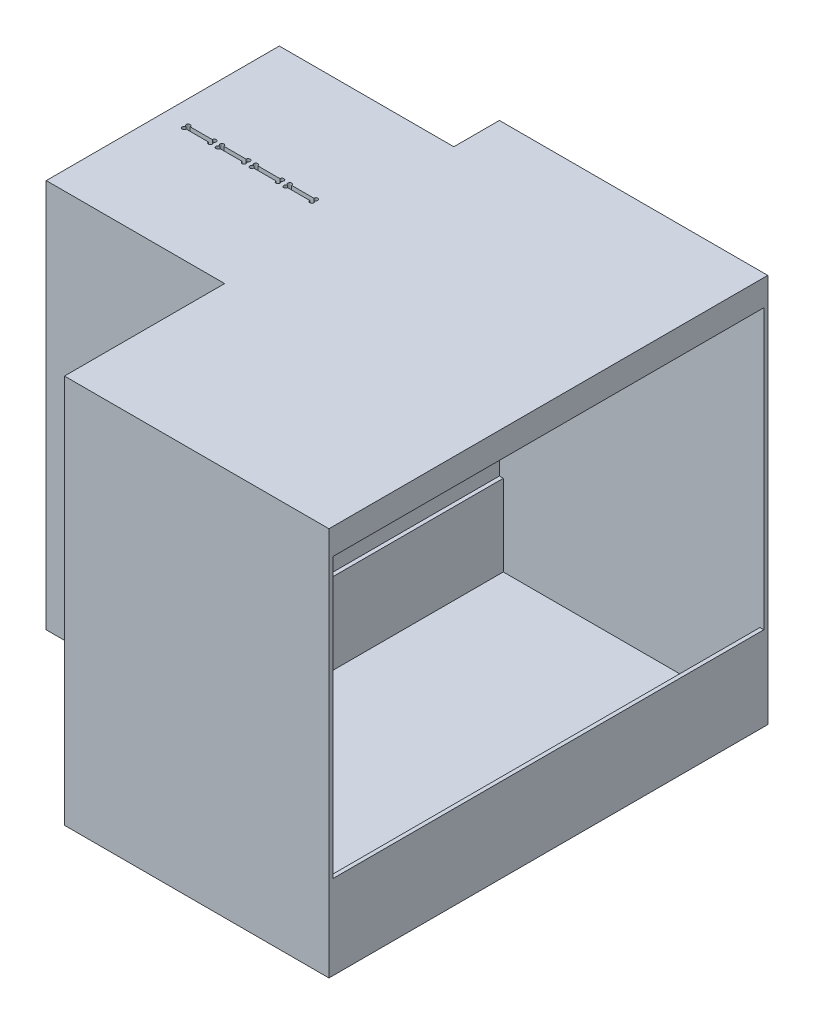
from build123d import *

# Parameters (mm, degrees)
SKETCH_3490_W                        = 374
SKETCH_3490_H                        = 597.6
EXTRUDE_3668_DEPTH                   = 680.2
SKETCH_3709_W                        = 368
SKETCH_3709_H                        = 427
CUT_EXTRUDE_3768_DEPTH               = 406.2
SKETCH_3818_W                        = 170
SKETCH_3818_H                        = 183
CUT_EXTRUDE_3910_DEPTH               = 256
SKETCH_3961_W                        = 170
SKETCH_3961_H                        = 183
CUT_EXTRUDE_4290_DEPTH               = 767.1086607
SKETCH_4336_W                        = 394.2
SKETCH_4336_H                        = 368
CUT_EXTRUDE_4864_DEPTH               = 124.6
SKETCH_4913_W                        = 394.2
SKETCH_4913_H                        = 368
CUT_EXTRUDE_5053_DEPTH               = 34
SKETCH_5123_W                        = 15.454545454
SKETCH_5123_H                        = 12
CUT_EXTRUDE_5277_DEPTH               = 256
PATTERN_LINEAR_5331_COUNT            = 5
PATTERN_LINEAR_5331_PITCH            = 30.909090909
PATTERN_LINEAR_5399_COUNT            = 2
PATTERN_LINEAR_5399_PITCH            = 176
PATTERN_LINEAR_5399_COUNT_DIR2       = 2
PATTERN_LINEAR_5399_PITCH_DIR2       = 201
PATTERN_LINEAR_5399_COPY_1_SKETCH_W  = 15.454545454
PATTERN_LINEAR_5399_COPY_1_SKETCH_H  = 12
PATTERN_LINEAR_5399_COPY_1_DEPTH     = 256
PATTERN_LINEAR_5399_COPY_2_SKETCH_W  = 15.454545454
PATTERN_LINEAR_5399_COPY_2_SKETCH_H  = 12
PATTERN_LINEAR_5399_COPY_2_DEPTH     = 256
PATTERN_LINEAR_5399_COPY_3_SKETCH_W  = 15.454545454
PATTERN_LINEAR_5399_COPY_3_SKETCH_H  = 12
PATTERN_LINEAR_5399_COPY_3_DEPTH     = 256
PATTERN_LINEAR_5399_COPY_4_SKETCH_W  = 15.454545454
PATTERN_LINEAR_5399_COPY_4_SKETCH_H  = 12
PATTERN_LINEAR_5399_COPY_4_DEPTH     = 256
PATTERN_LINEAR_5399_COPY_5_SKETCH_W  = 15.454545454
PATTERN_LINEAR_5399_COPY_5_SKETCH_H  = 12
PATTERN_LINEAR_5399_COPY_5_DEPTH     = 256
PATTERN_LINEAR_5399_COPY_6_SKETCH_W  = 15.454545454
PATTERN_LINEAR_5399_COPY_6_SKETCH_H  = 12
PATTERN_LINEAR_5399_COPY_6_DEPTH     = 256
PATTERN_LINEAR_5399_COPY_7_SKETCH_W  = 15.454545454
PATTERN_LINEAR_5399_COPY_7_SKETCH_H  = 12
PATTERN_LINEAR_5399_COPY_7_DEPTH     = 256
PATTERN_LINEAR_5399_COPY_8_SKETCH_W  = 15.454545454
PATTERN_LINEAR_5399_COPY_8_SKETCH_H  = 12
PATTERN_LINEAR_5399_COPY_8_DEPTH     = 256
PATTERN_LINEAR_5399_COPY_9_SKETCH_W  = 15.454545454
PATTERN_LINEAR_5399_COPY_9_SKETCH_H  = 12
PATTERN_LINEAR_5399_COPY_9_DEPTH     = 256
PATTERN_LINEAR_5399_COPY_10_SKETCH_W = 15.454545454
PATTERN_LINEAR_5399_COPY_10_SKETCH_H = 12
PATTERN_LINEAR_5399_COPY_10_DEPTH    = 256
PATTERN_LINEAR_5399_COPY_11_SKETCH_W = 15.454545454
PATTERN_LINEAR_5399_COPY_11_SKETCH_H = 12
PATTERN_LINEAR_5399_COPY_11_DEPTH    = 256
PATTERN_LINEAR_5399_COPY_12_SKETCH_W = 15.454545454
PATTERN_LINEAR_5399_COPY_12_SKETCH_H = 12
PATTERN_LINEAR_5399_COPY_12_DEPTH    = 256
EXTRUDE_6088_DEPTH                   = 240
SKETCH_6169_W                        = 406.2
SKETCH_6169_H                        = 597.6
EXTRUDE_6328_DEPTH                   = 6
SKETCH_14_W                          = 268
SKETCH_14_H                          = 597.6
CUT_EXTRUDE_1_DEPTH                  = 16
CUT_EXTRUDE_2_REACH                  = 861.908
SKETCH_15_W                          = 608
SKETCH_15_H                          = 124.6
SKETCH_16_W                          = 608
SKETCH_16_H                          = 123.22
EXTRUDE_1_DEPTH                      = 6
MOVE_FACE_6953_BY                    = 54
MOVE_FACE_6953_2_BY                  = 54
OTHER_START                          = 286.8
OTHER_1_DEPTH                        = 12
OTHER_START_2                        = -298.8
OTHER_2_DEPTH                        = 12


# Read off the part's stored shape, not the designer's step: Выступы и прорези-Прорезь1, Выступы и прорези-Прорезь2
with BuildPart() as part:
    # Sketch 3490 → Extrude 3668 (new body)
    with BuildSketch(Plane(origin=(0, 0, 0), x_dir=(0, 0, -1), z_dir=(1, 0, 0))):
        Rectangle(SKETCH_3490_W, SKETCH_3490_H)
    extrude(amount=EXTRUDE_3668_DEPTH)

    # Sketch 3709 → Cut-Extrude 3768 (cut)
    with BuildSketch(Plane(origin=(680.2, 0, 0), x_dir=(0, 0, -1), z_dir=(1, 0, 0))):
        with Locations((-3, 45.3)):
            Rectangle(SKETCH_3709_W, SKETCH_3709_H)
    extrude(amount=-CUT_EXTRUDE_3768_DEPTH, mode=Mode.SUBTRACT)

    # Sketch 3818 → Cut-Extrude 3910 (cut)
    with BuildSketch(Plane(origin=(274, 0, 0), x_dir=(0, 0, -1), z_dir=(1, 0, 0))):
        with Locations((-96, 167.3)):
            Rectangle(SKETCH_3818_W, SKETCH_3818_H)
    cut_extrude_3910 = extrude(amount=-CUT_EXTRUDE_3910_DEPTH, mode=Mode.SUBTRACT)

    # Sketch 3961 → Cut-Extrude 4290 (cut, through all)
    with BuildSketch(Plane.ZY):
        with Locations((96, 167.3)):
            Rectangle(SKETCH_3961_W, SKETCH_3961_H)
    cut_extrude_4290 = extrude(amount=-CUT_EXTRUDE_4290_DEPTH, mode=Mode.SUBTRACT)

    # Sketch 4336 → Cut-Extrude 4864 (cut)
    with BuildSketch(Plane(origin=(0, -168.2, 0), x_dir=(1, 0, 0), z_dir=(0, 1, 0))):
        with Locations((477.1, -3)):
            Rectangle(SKETCH_4336_W, SKETCH_4336_H)
    extrude(amount=-CUT_EXTRUDE_4864_DEPTH, mode=Mode.SUBTRACT)

    # Sketch 4913 → Cut-Extrude 5053 (cut)
    with BuildSketch(Plane.XZ.offset(-258.8)):
        with Locations((477.1, 3)):
            Rectangle(SKETCH_4913_W, SKETCH_4913_H)
    extrude(amount=-CUT_EXTRUDE_5053_DEPTH, mode=Mode.SUBTRACT)

    # Sketch 5123 → Cut-Extrude 5277 (cut)
    with BuildSketch(Plane(origin=(274, 0, 0), x_dir=(0, 0, -1), z_dir=(1, 0, 0))):
        with Locations((-157.818181818, 69.8)):
            Rectangle(SKETCH_5123_W, SKETCH_5123_H)
    cut_extrude_5277 = extrude(amount=-CUT_EXTRUDE_5277_DEPTH, mode=Mode.SUBTRACT)

    # Pattern Linear 5331: Cut-Extrude 5277 ×5
    with Locations(*[(0, 0, -i * PATTERN_LINEAR_5331_PITCH) for i in range(1, PATTERN_LINEAR_5331_COUNT)]):
        add(cut_extrude_5277, mode=Mode.SUBTRACT)

    # Pattern Linear 5399: Cut-Extrude 3910, Cut-Extrude 4290, Cut-Extrude 5277 2 × 2
    with Locations(*[(0, -j * PATTERN_LINEAR_5399_PITCH_DIR2, -i * PATTERN_LINEAR_5399_PITCH) for i in range(PATTERN_LINEAR_5399_COUNT) for j in range(PATTERN_LINEAR_5399_COUNT_DIR2) if (i, j) != (0, 0)]):
        add(cut_extrude_3910, mode=Mode.SUBTRACT)
        add(cut_extrude_4290, mode=Mode.SUBTRACT)
        add(cut_extrude_5277, mode=Mode.SUBTRACT)

    # Pattern Linear 5399 copy 1 sketch → Pattern Linear 5399 copy 1 (cut)
    with BuildSketch(Plane(origin=(274, -201, -30.909090909), x_dir=(0, 0, -1), z_dir=(1, 0, 0))):
        with Locations((-157.818181818, 69.8)):
            Rectangle(PATTERN_LINEAR_5399_COPY_1_SKETCH_W, PATTERN_LINEAR_5399_COPY_1_SKETCH_H)
    extrude(amount=-PATTERN_LINEAR_5399_COPY_1_DEPTH, mode=Mode.SUBTRACT)

    # Pattern Linear 5399 copy 2 sketch → Pattern Linear 5399 copy 2 (cut)
    with BuildSketch(Plane(origin=(274, 0, -206.909090909), x_dir=(0, 0, -1), z_dir=(1, 0, 0))):
        with Locations((-157.818181818, 69.8)):
            Rectangle(PATTERN_LINEAR_5399_COPY_2_SKETCH_W, PATTERN_LINEAR_5399_COPY_2_SKETCH_H)
    extrude(amount=-PATTERN_LINEAR_5399_COPY_2_DEPTH, mode=Mode.SUBTRACT)

    # Pattern Linear 5399 copy 3 sketch → Pattern Linear 5399 copy 3 (cut)
    with BuildSketch(Plane(origin=(274, -201, -206.909090909), x_dir=(0, 0, -1), z_dir=(1, 0, 0))):
        with Locations((-157.818181818, 69.8)):
            Rectangle(PATTERN_LINEAR_5399_COPY_3_SKETCH_W, PATTERN_LINEAR_5399_COPY_3_SKETCH_H)
    extrude(amount=-PATTERN_LINEAR_5399_COPY_3_DEPTH, mode=Mode.SUBTRACT)

    # Pattern Linear 5399 copy 4 sketch → Pattern Linear 5399 copy 4 (cut)
    with BuildSketch(Plane(origin=(274, -201, -61.818181818), x_dir=(0, 0, -1), z_dir=(1, 0, 0))):
        with Locations((-157.818181818, 69.8)):
            Rectangle(PATTERN_LINEAR_5399_COPY_4_SKETCH_W, PATTERN_LINEAR_5399_COPY_4_SKETCH_H)
    extrude(amount=-PATTERN_LINEAR_5399_COPY_4_DEPTH, mode=Mode.SUBTRACT)

    # Pattern Linear 5399 copy 5 sketch → Pattern Linear 5399 copy 5 (cut)
    with BuildSketch(Plane(origin=(274, 0, -237.818181818), x_dir=(0, 0, -1), z_dir=(1, 0, 0))):
        with Locations((-157.818181818, 69.8)):
            Rectangle(PATTERN_LINEAR_5399_COPY_5_SKETCH_W, PATTERN_LINEAR_5399_COPY_5_SKETCH_H)
    extrude(amount=-PATTERN_LINEAR_5399_COPY_5_DEPTH, mode=Mode.SUBTRACT)

    # Pattern Linear 5399 copy 6 sketch → Pattern Linear 5399 copy 6 (cut)
    with BuildSketch(Plane(origin=(274, -201, -237.818181818), x_dir=(0, 0, -1), z_dir=(1, 0, 0))):
        with Locations((-157.818181818, 69.8)):
            Rectangle(PATTERN_LINEAR_5399_COPY_6_SKETCH_W, PATTERN_LINEAR_5399_COPY_6_SKETCH_H)
    extrude(amount=-PATTERN_LINEAR_5399_COPY_6_DEPTH, mode=Mode.SUBTRACT)

    # Pattern Linear 5399 copy 7 sketch → Pattern Linear 5399 copy 7 (cut)
    with BuildSketch(Plane(origin=(274, -201, -92.727272727), x_dir=(0, 0, -1), z_dir=(1, 0, 0))):
        with Locations((-157.818181818, 69.8)):
            Rectangle(PATTERN_LINEAR_5399_COPY_7_SKETCH_W, PATTERN_LINEAR_5399_COPY_7_SKETCH_H)
    extrude(amount=-PATTERN_LINEAR_5399_COPY_7_DEPTH, mode=Mode.SUBTRACT)

    # Pattern Linear 5399 copy 8 sketch → Pattern Linear 5399 copy 8 (cut)
    with BuildSketch(Plane(origin=(274, 0, -268.727272727), x_dir=(0, 0, -1), z_dir=(1, 0, 0))):
        with Locations((-157.818181818, 69.8)):
            Rectangle(PATTERN_LINEAR_5399_COPY_8_SKETCH_W, PATTERN_LINEAR_5399_COPY_8_SKETCH_H)
    extrude(amount=-PATTERN_LINEAR_5399_COPY_8_DEPTH, mode=Mode.SUBTRACT)

    # Pattern Linear 5399 copy 9 sketch → Pattern Linear 5399 copy 9 (cut)
    with BuildSketch(Plane(origin=(274, -201, -268.727272727), x_dir=(0, 0, -1), z_dir=(1, 0, 0))):
        with Locations((-157.818181818, 69.8)):
            Rectangle(PATTERN_LINEAR_5399_COPY_9_SKETCH_W, PATTERN_LINEAR_5399_COPY_9_SKETCH_H)
    extrude(amount=-PATTERN_LINEAR_5399_COPY_9_DEPTH, mode=Mode.SUBTRACT)

    # Pattern Linear 5399 copy 10 sketch → Pattern Linear 5399 copy 10 (cut)
    with BuildSketch(Plane(origin=(274, -201, -123.636363636), x_dir=(0, 0, -1), z_dir=(1, 0, 0))):
        with Locations((-157.818181818, 69.8)):
            Rectangle(PATTERN_LINEAR_5399_COPY_10_SKETCH_W, PATTERN_LINEAR_5399_COPY_10_SKETCH_H)
    extrude(amount=-PATTERN_LINEAR_5399_COPY_10_DEPTH, mode=Mode.SUBTRACT)

    # Pattern Linear 5399 copy 11 sketch → Pattern Linear 5399 copy 11 (cut)
    with BuildSketch(Plane(origin=(274, 0, -299.636363636), x_dir=(0, 0, -1), z_dir=(1, 0, 0))):
        with Locations((-157.818181818, 69.8)):
            Rectangle(PATTERN_LINEAR_5399_COPY_11_SKETCH_W, PATTERN_LINEAR_5399_COPY_11_SKETCH_H)
    extrude(amount=-PATTERN_LINEAR_5399_COPY_11_DEPTH, mode=Mode.SUBTRACT)

    # Pattern Linear 5399 copy 12 sketch → Pattern Linear 5399 copy 12 (cut)
    with BuildSketch(Plane(origin=(274, -201, -299.636363636), x_dir=(0, 0, -1), z_dir=(1, 0, 0))):
        with Locations((-157.818181818, 69.8)):
            Rectangle(PATTERN_LINEAR_5399_COPY_12_SKETCH_W, PATTERN_LINEAR_5399_COPY_12_SKETCH_H)
    extrude(amount=-PATTERN_LINEAR_5399_COPY_12_DEPTH, mode=Mode.SUBTRACT)

    # Sketch 5491 → Extrude 6088 (add)
    with BuildSketch(Plane.XY.offset(187)):
        Polygon((680.2, -298.8), (680.2, -168.2), (674.2, -168.2), (674.2, -292.8), (280, -292.8), (280, -168.2), (274, -168.2), (274, -298.8), align=None)
        Polygon((674.2, 258.8), (680.2, 258.8), (680.2, 298.8), (274, 298.8), (274, 258.8), (280, 258.8), (280, 292.8), (674.2, 292.8), align=None)
    extrude(amount=EXTRUDE_6088_DEPTH)

    # Sketch 6169 → Extrude 6328 (add)
    with BuildSketch(Plane.XY.offset(427)):
        with Locations((477.1, 0)):
            Rectangle(SKETCH_6169_W, SKETCH_6169_H)
    extrude(amount=EXTRUDE_6328_DEPTH)

    # Эскиз14 → Вырез-Вытянуть1 (cut)
    with BuildSketch(Plane(origin=(0, 0, -187), x_dir=(-1, 0, 0), z_dir=(0, 0, -1))):
        with Locations((-134, 0)):
            Rectangle(SKETCH_14_W, SKETCH_14_H)
    extrude(amount=-CUT_EXTRUDE_1_DEPTH, mode=Mode.SUBTRACT)

    # Эскиз15 → Вырез-Вытянуть2 (cut, up to next)
    with BuildSketch(Plane(origin=(680.2, 0, 0), x_dir=(0, 0, -1), z_dir=(1, 0, 0)), mode=Mode.PRIVATE) as cut_extrude_2_sk1:
        with Locations((-123, -230.5)):
            Rectangle(SKETCH_15_W, SKETCH_15_H)
    cut_extrude_2_tool1 = extrude(cut_extrude_2_sk1.sketch, amount=-CUT_EXTRUDE_2_REACH, mode=Mode.PRIVATE) & part.part
    add(cut_extrude_2_tool1.solids().sort_by_distance((680.2, -230.5, 123))[0], mode=Mode.SUBTRACT)

    # Эскиз16 → Бобышка-Вытянуть1 (add)
    with BuildSketch(Plane(origin=(680.2, 0, 0), x_dir=(0, 0, -1), z_dir=(1, 0, 0))):
        with Locations((-123, -231.19)):
            Rectangle(SKETCH_16_W, SKETCH_16_H)
    extrude(amount=-EXTRUDE_1_DEPTH)

    # Move Face 6953: a face moved outward by 54.0
    extrude(part.faces().sort_by_distance((474.1, 0, -187))[0], amount=MOVE_FACE_6953_BY, dir=(0, 0, -1))

    # Move Face 6953 2: a face moved inward by 54.0
    extrude(part.faces().sort_by_distance((477.107021178, 0.977722253, -181))[0], amount=MOVE_FACE_6953_2_BY, dir=(0, 0, -1), mode=Mode.SUBTRACT)

    # Исправление1 outline → Исправление1 (cut)
    with BuildSketch(Plane(origin=(0, 0, 0), x_dir=(1, 0, 0), z_dir=(0, 1, 0)).offset(OTHER_START)):
        with BuildLine():
            ThreePointArc((38.975, -4.925), (33.768324317, -2.768324317), (35.925, -7.975))
            Line((35.925, -7.975), (35.925, -8.025))
            ThreePointArc((35.925, -8.025), (33.768324317, -13.231675683), (38.975, -11.075))
            Line((38.975, -11.075), (73.025, -11.075))
            ThreePointArc((73.025, -11.075), (78.231675683, -13.231675683), (76.075, -8.025))
            Line((76.075, -8.025), (76.075, -7.975))
            ThreePointArc((76.075, -7.975), (78.231675683, -2.768324317), (73.025, -4.925))
            Line((73.025, -4.925), (38.975, -4.925))
        make_face()
        with BuildLine():
            ThreePointArc((87.9, -8.025), (85.743324317, -13.231675683), (90.95, -11.075))
            Line((90.95, -11.075), (125, -11.075))
            ThreePointArc((125, -11.075), (130.206675683, -13.231675683), (128.05, -8.025))
            Line((128.05, -8.025), (128.05, -7.975))
            ThreePointArc((128.05, -7.975), (130.206675683, -2.768324317), (125, -4.925))
            Line((125, -4.925), (90.95, -4.925))
            ThreePointArc((90.95, -4.925), (85.743324317, -2.768324317), (87.9, -7.975))
            Line((87.9, -7.975), (87.9, -8.025))
        make_face()
        with BuildLine():
            ThreePointArc((139.875, -8.025), (137.718324317, -13.231675683), (142.925, -11.075))
            Line((142.925, -11.075), (176.975, -11.075))
            ThreePointArc((176.975, -11.075), (182.181675683, -13.231675683), (180.025, -8.025))
            Line((180.025, -8.025), (180.025, -7.975))
            ThreePointArc((180.025, -7.975), (182.181675683, -2.768324317), (176.975, -4.925))
            Line((176.975, -4.925), (142.925, -4.925))
            ThreePointArc((142.925, -4.925), (137.718324317, -2.768324317), (139.875, -7.975))
            Line((139.875, -7.975), (139.875, -8.025))
        make_face()
        with BuildLine():
            ThreePointArc((191.85, -8.025), (189.693324317, -13.231675683), (194.9, -11.075))
            Line((194.9, -11.075), (228.95, -11.075))
            ThreePointArc((228.95, -11.075), (234.156675683, -13.231675683), (232, -8.025))
            Line((232, -8.025), (232, -7.975))
            ThreePointArc((232, -7.975), (234.156675683, -2.768324317), (228.95, -4.925))
            Line((228.95, -4.925), (194.9, -4.925))
            ThreePointArc((194.9, -4.925), (189.693324317, -2.768324317), (191.85, -7.975))
            Line((191.85, -7.975), (191.85, -8.025))
        make_face()
    extrude(amount=OTHER_1_DEPTH, mode=Mode.SUBTRACT)

    # Other 2 outline → Other 2 (cut)
    with BuildSketch(Plane(origin=(0, 0, 0), x_dir=(1, 0, 0), z_dir=(0, 1, 0)).offset(OTHER_START_2)):
        with BuildLine():
            Line((35.925, -7.975), (35.925, -8.025))
            ThreePointArc((35.925, -8.025), (33.768324317, -13.231675683), (38.975, -11.075))
            Line((38.975, -11.075), (73.025, -11.075))
            ThreePointArc((73.025, -11.075), (78.231675683, -13.231675683), (76.075, -8.025))
            Line((76.075, -8.025), (76.075, -7.975))
            ThreePointArc((76.075, -7.975), (78.231675683, -2.768324317), (73.025, -4.925))
            Line((73.025, -4.925), (38.975, -4.925))
            ThreePointArc((38.975, -4.925), (33.768324317, -2.768324317), (35.925, -7.975))
        make_face()
        with BuildLine():
            Line((90.95, -11.075), (125, -11.075))
            ThreePointArc((125, -11.075), (130.206675683, -13.231675683), (128.05, -8.025))
            Line((128.05, -8.025), (128.05, -7.975))
            ThreePointArc((128.05, -7.975), (130.206675683, -2.768324317), (125, -4.925))
            Line((125, -4.925), (90.95, -4.925))
            ThreePointArc((90.95, -4.925), (85.743324317, -2.768324317), (87.9, -7.975))
            Line((87.9, -7.975), (87.9, -8.025))
            ThreePointArc((87.9, -8.025), (85.743324317, -13.231675683), (90.95, -11.075))
        make_face()
        with BuildLine():
            Line((142.925, -11.075), (176.975, -11.075))
            ThreePointArc((176.975, -11.075), (182.181675683, -13.231675683), (180.025, -8.025))
            Line((180.025, -8.025), (180.025, -7.975))
            ThreePointArc((180.025, -7.975), (182.181675683, -2.768324317), (176.975, -4.925))
            Line((176.975, -4.925), (142.925, -4.925))
            ThreePointArc((142.925, -4.925), (137.718324317, -2.768324317), (139.875, -7.975))
            Line((139.875, -7.975), (139.875, -8.025))
            ThreePointArc((139.875, -8.025), (137.718324317, -13.231675683), (142.925, -11.075))
        make_face()
        with BuildLine():
            Line((194.9, -11.075), (228.95, -11.075))
            ThreePointArc((228.95, -11.075), (234.156675683, -13.231675683), (232, -8.025))
            Line((232, -8.025), (232, -7.975))
            ThreePointArc((232, -7.975), (234.156675683, -2.768324317), (228.95, -4.925))
            Line((228.95, -4.925), (194.9, -4.925))
            ThreePointArc((194.9, -4.925), (189.693324317, -2.768324317), (191.85, -7.975))
            Line((191.85, -7.975), (191.85, -8.025))
            ThreePointArc((191.85, -8.025), (189.693324317, -13.231675683), (194.9, -11.075))
        make_face()
    extrude(amount=OTHER_2_DEPTH, mode=Mode.SUBTRACT)


solid = part.part
